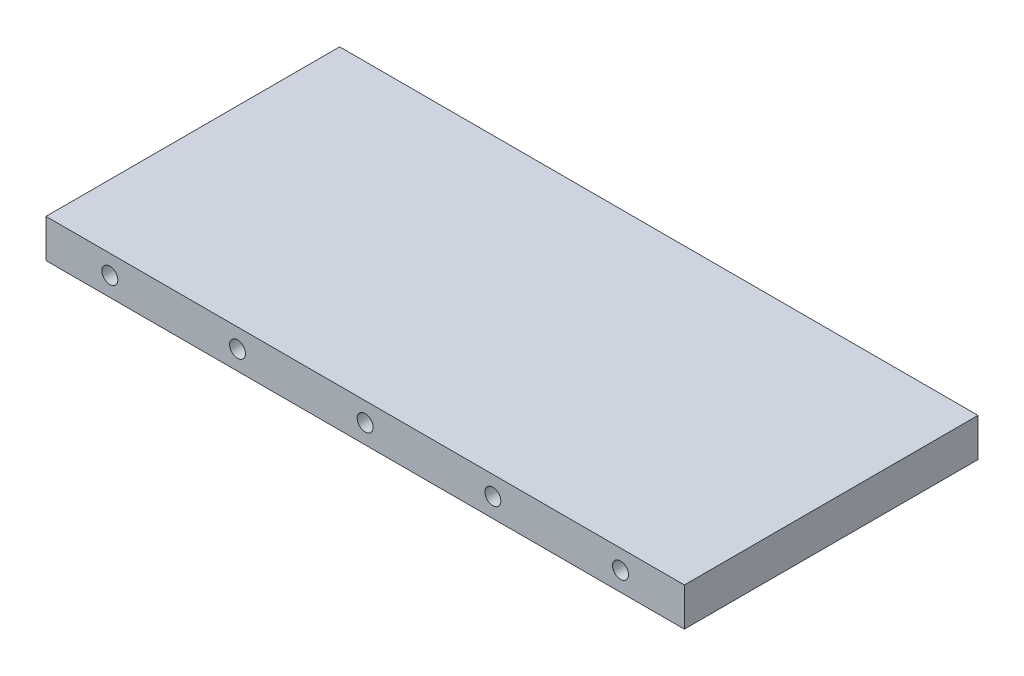
from build123d import *

# Parameters (mm, degrees)
SKETCH1_W               = 100
SKETCH1_H               = 46
BOSS_EXTRUDE1_DEPTH     = 6
TAP_DRILL_FOR_M3_TAP1_D = 2.5


with BuildPart() as part:
    # Sketch1 → Boss-Extrude1 (new body)
    with BuildSketch(Plane(origin=(0, 0, 0), x_dir=(1, 0, 0), z_dir=(0, 1, 0))):
        with Locations((50, 23)):
            Rectangle(SKETCH1_W, SKETCH1_H)
    extrude(amount=BOSS_EXTRUDE1_DEPTH)

    # Tap Drill for M3 Tap1 (through all)
    with Locations(Plane(origin=(0, 0, -46), x_dir=(-1, 0, 0), z_dir=(0, 0, -1))):
        with Locations((-90, 3), (-70, 3), (-50, 3), (-30, 3), (-10, 3)):
            Hole(TAP_DRILL_FOR_M3_TAP1_D / 2)


solid = part.part
